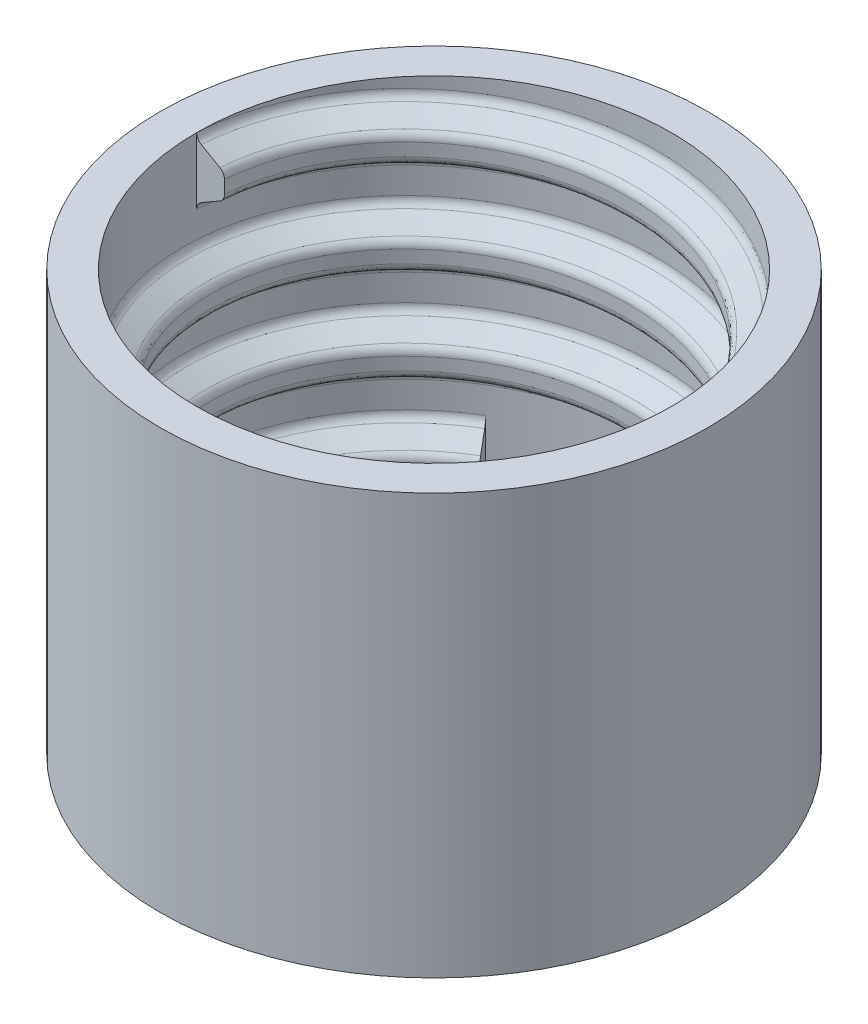
from build123d import *
from build123d.topology import SkipClean

# Parameters (mm, degrees)
SKETCH1_R           = 15
BOSS_EXTRUDE1_DEPTH = 20
SKETCH10_R          = 13
CUT_EXTRUDE2_DEPTH  = 20
THREAD1_PITCH       = 5.08
BOSS_EXTRUDE3_START = 3
SKETCH20_R          = 15
BOSS_EXTRUDE3_DEPTH = 3
SKETCH19_R          = 6.5
CUT_EXTRUDE3_DEPTH  = 1.5
SKETCH47_R          = 0.5
CUT_EXTRUDE10_DEPTH = 1.5
SKETCH49_R          = 0.5
CUT_EXTRUDE13_DEPTH = 1.5
SKETCH50_R          = 0.5
CUT_EXTRUDE14_DEPTH = 1.5
SKETCH51_R          = 0.5
CUT_EXTRUDE15_DEPTH = 1.5
CIRPATTERN1_COUNT   = 18
CIRPATTERN2_COUNT   = 12
CIRPATTERN3_COUNT   = 6


with BuildPart() as part:
    # Sketch1 → Boss-Extrude1 (new body)
    with BuildSketch(Plane(origin=(0, 0, 0), x_dir=(1, 0, 0), z_dir=(0, 1, 0))):
        with Locations(Location((0, 0, 0), (0, 0, 270))):
            Circle(SKETCH1_R)
    extrude(amount=BOSS_EXTRUDE1_DEPTH)

    # Sketch10 → Cut-Extrude2 (cut)
    with BuildSketch(Plane(origin=(0, 20, 0), x_dir=(1, 0, 0), z_dir=(0, 1, 0))):
        with Locations(Location((0, 0, 0), (0, 0, 270))):
            Circle(SKETCH10_R)
    extrude(amount=-CUT_EXTRUDE2_DEPTH, mode=Mode.SUBTRACT)

    # Thread1: the profile of Thread Profile2 profile screwed along a right-hand helix of 3.149606 turns, 12 arcs to a turn; built about Z, then put on its axis
    with SkipClean():  # the faces are left unmerged after this step: merging them gives an invalid solid
        thread1_z = Axis((0, 0, 0), (0, 0, 1))
        thread1_corners = [(13.0006, 0, 0), (13.0006, 0, 3.634587873), (13, 0, 3.634587873), (12.746, 0, 3.194646968), (11.73, 0, 2.608059095), (11.476, 0, 2.16811819), (11.476, 0, 1.466469684), (11.73, 0, 1.026528779), (12.746, 0, 0.439940905), (13, 0, 0)]
        with BuildLine(mode=Mode.PRIVATE) as thread1_profile:
            Line(thread1_corners[0], thread1_corners[1])
            Line(thread1_corners[3], thread1_corners[4])
            Line(thread1_corners[5], thread1_corners[6])
            Line(thread1_corners[7], thread1_corners[8])
            Line(thread1_corners[9], thread1_corners[0])
            Line(thread1_corners[2], thread1_corners[1])
            ThreePointArc((13, 0, 3.634587873), (12.931940905, 0, 3.380587873), (12.746, 0, 3.194646968))
            ThreePointArc((11.73, 0, 2.608059095), (11.544059095, 0, 2.42211819), (11.476, 0, 2.16811819))
            ThreePointArc((11.476, 0, 1.466469684), (11.544059095, 0, 1.212469684), (11.73, 0, 1.026528779))
            ThreePointArc((12.746, 0, 0.439940905), (12.931940905, 0, 0.254), (13, 0, 0))
        thread1_cap = Face(thread1_profile.wire())
        thread1_arcs = [((13, 0, 3.634587873), (13, 0, 3.341293937), (12.746, 0, 3.194646968), (1, 0.866025403784437, 1)), ((11.73, 0, 2.608059095), (11.476, 0, 2.461412127), (11.476, 0, 2.16811819), (1, 0.8660254037844386, 1)), ((11.476, 0, 1.466469684), (11.476, 0, 1.173175747), (11.73, 0, 1.026528779), (1, 0.8660254037844376, 1)), ((12.746, 0, 0.439940905), (13, 0, 0.293293937), (13, 0, 0), (1, 0.8660254037844372, 1))]  # start, shoulder, end, weights
        thread1_turn_angles = [0, 15, 30, 45, 60, 75, 90, 105, 120, 135, 150, 165, 180, 195, 210, 225, 240, 255, 270, 285, 300, 315, 330, 345, 360]
        thread1_turn_weights = [1, 0.9659258262890683, 1, 0.9659258262890683, 1, 0.9659258262890683, 1, 0.9659258262890683, 1, 0.9659258262890683, 1, 0.9659258262890683, 1, 0.9659258262890683, 1, 0.9659258262890683, 1, 0.9659258262890683, 1, 0.9659258262890683, 1, 0.9659258262890683, 1, 0.9659258262890683, 1]
        thread1_turn_rails = [Edge.make_bspline([Vector(p[0], p[1], 0).rotate(thread1_z, thread1_turn_angles[k]) / thread1_turn_weights[k] + Vector(0, 0, p[2] + THREAD1_PITCH * thread1_turn_angles[k] / 360) for k in range(25)], [0, 0, 0, 1, 1, 2, 2, 3, 3, 4, 4, 5, 5, 6, 6, 7, 7, 8, 8, 9, 9, 10, 10, 11, 11, 12, 12, 12], 2, thread1_turn_weights) for p in thread1_corners]
        thread1_turn_sides = [*[Face.make_surface_from_curves(thread1_turn_rails[p[0]], thread1_turn_rails[p[1]]) for p in [(0, 1), (3, 4), (5, 6), (7, 8), (9, 0), (2, 1)]], *[Face.make_bezier_surface([[Vector(p[j][0], p[j][1], 0).rotate(thread1_z, thread1_turn_angles[2 * i + k]) / thread1_turn_weights[2 * i + k] + Vector(0, 0, p[j][2] + THREAD1_PITCH * thread1_turn_angles[2 * i + k] / 360) for k in range(3)] for j in range(3)], [[p[3][j] * thread1_turn_weights[2 * i + k] for k in range(3)] for j in range(3)]) for p in thread1_arcs for i in range(12)]]
        thread1_last_angles = [1080, 1095, 1110, 1121.929133858, 1133.858267717]
        thread1_last_weights = [1, 0.9659258262890683, 1, 0.9784040075425771, 1]
        thread1_last_rails = [Edge.make_bspline([Vector(p[0], p[1], 0).rotate(thread1_z, thread1_last_angles[k]) / thread1_last_weights[k] + Vector(0, 0, p[2] + THREAD1_PITCH * thread1_last_angles[k] / 360) for k in range(5)], [0, 0, 0, 1, 1, 2, 2, 2], 2, thread1_last_weights) for p in thread1_corners]
        thread1_last_sides = [*[Face.make_surface_from_curves(thread1_last_rails[p[0]], thread1_last_rails[p[1]]) for p in [(0, 1), (3, 4), (5, 6), (7, 8), (9, 0), (2, 1)]], *[Face.make_bezier_surface([[Vector(p[j][0], p[j][1], 0).rotate(thread1_z, thread1_last_angles[2 * i + k]) / thread1_last_weights[2 * i + k] + Vector(0, 0, p[j][2] + THREAD1_PITCH * thread1_last_angles[2 * i + k] / 360) for k in range(3)] for j in range(3)], [[p[3][j] * thread1_last_weights[2 * i + k] for k in range(3)] for j in range(3)]) for p in thread1_arcs for i in range(2)]]
        thread1 = Plane(origin=(0, 20, 0), x_dir=(-1, 0, 0), z_dir=(0, -1, 0)) * Solid(Shell([*[p.moved(Location((0, 0, THREAD1_PITCH * i))) for i in range(3) for p in thread1_turn_sides], *thread1_last_sides, thread1_cap, thread1_cap.rotate(thread1_z, 1133.858267717).moved(Location((0, 0, THREAD1_PITCH * 1133.858267717 / 360)))]))
        add(thread1)

    # Sketch20 → Boss-Extrude3 (add)
    with SkipClean():  # the faces are left unmerged after this step: merging them gives an invalid solid
        with BuildSketch(Plane.XZ.offset(BOSS_EXTRUDE3_START)):
            with Locations(Location((0, 0, 0), (0, 0, 270))):
                Circle(SKETCH20_R)
        extrude(amount=-BOSS_EXTRUDE3_DEPTH)

    # Sketch19 → Cut-Extrude3 (cut)
    with SkipClean():  # the faces are left unmerged after this step: merging them gives an invalid solid
        with BuildSketch(Plane(origin=(0, 0, 0), x_dir=(-1, 0, 0), z_dir=(0, -1, 0))):
            with Locations(Location((0, 0, 0), (0, 0, 90))):
                Circle(SKETCH19_R)
        extrude(amount=CUT_EXTRUDE3_DEPTH, mode=Mode.SUBTRACT)

    # Sketch47 → Cut-Extrude10 (cut)
    with SkipClean():  # the faces are left unmerged after this step: merging them gives an invalid solid
        with BuildSketch(Plane(origin=(0, -1.5, 0), x_dir=(1, 0, 0), z_dir=(0, 1, 0))):
            with Locations(Location((0, 0, 0), (0, 0, 270))):
                Circle(SKETCH47_R)
        extrude(amount=-CUT_EXTRUDE10_DEPTH, mode=Mode.SUBTRACT)

    # Sketch49 → Cut-Extrude13 (cut)
    with SkipClean():  # the faces are left unmerged after this step: merging them gives an invalid solid
        with BuildSketch(Plane(origin=(0, -1.5, 0), x_dir=(1, 0, 0), z_dir=(0, 1, 0))):
            with Locations(Location((0, 0, 0), (0, 0, 270))):
                Circle(SKETCH49_R)
            with Locations(Location((1.67, 0, 0), (0, 0, 270))):
                Circle(SKETCH49_R)
        cut_extrude13 = extrude(amount=-CUT_EXTRUDE13_DEPTH, mode=Mode.SUBTRACT)

    # Sketch50 → Cut-Extrude14 (cut)
    with SkipClean():  # the faces are left unmerged after this step: merging them gives an invalid solid
        with BuildSketch(Plane(origin=(0, -1.5, 0), x_dir=(1, 0, 0), z_dir=(0, 1, 0))):
            with Locations(Location((3.33, 0, 0), (0, 0, 270))):
                Circle(SKETCH50_R)
        cut_extrude14 = extrude(amount=-CUT_EXTRUDE14_DEPTH, mode=Mode.SUBTRACT)

    # Sketch51 → Cut-Extrude15 (cut)
    with SkipClean():  # the faces are left unmerged after this step: merging them gives an invalid solid
        with BuildSketch(Plane(origin=(0, -1.5, 0), x_dir=(1, 0, 0), z_dir=(0, 1, 0))):
            with Locations(Location((5, 0, 0), (0, 0, 270))):
                Circle(SKETCH51_R)
        cut_extrude15 = extrude(amount=-CUT_EXTRUDE15_DEPTH, mode=Mode.SUBTRACT)

    # CirPattern1: Cut-Extrude15 ×18 about axis
    with SkipClean():  # the faces are left unmerged after this step: merging them gives an invalid solid
        cirpattern1_axis = Axis((0, 0, 0), (0, 1, 0))
        for i in range(1, CIRPATTERN1_COUNT):
            add(cut_extrude15.rotate(cirpattern1_axis, i * 360 / CIRPATTERN1_COUNT), mode=Mode.SUBTRACT)

    # CirPattern2: Cut-Extrude14 ×12 about axis
    with SkipClean():  # the faces are left unmerged after this step: merging them gives an invalid solid
        cirpattern2_axis = Axis((0, 0, 0), (0, 1, 0))
        for i in range(1, CIRPATTERN2_COUNT):
            add(cut_extrude14.rotate(cirpattern2_axis, i * 360 / CIRPATTERN2_COUNT), mode=Mode.SUBTRACT)

    # CirPattern3: Cut-Extrude13 ×6 about axis
    with SkipClean():  # the faces are left unmerged after this step: merging them gives an invalid solid
        cirpattern3_axis = Axis((0, 0, 0), (0, 1, 0))
        for i in range(1, CIRPATTERN3_COUNT):
            add(cut_extrude13.rotate(cirpattern3_axis, i * 360 / CIRPATTERN3_COUNT), mode=Mode.SUBTRACT)


solid = part.part
